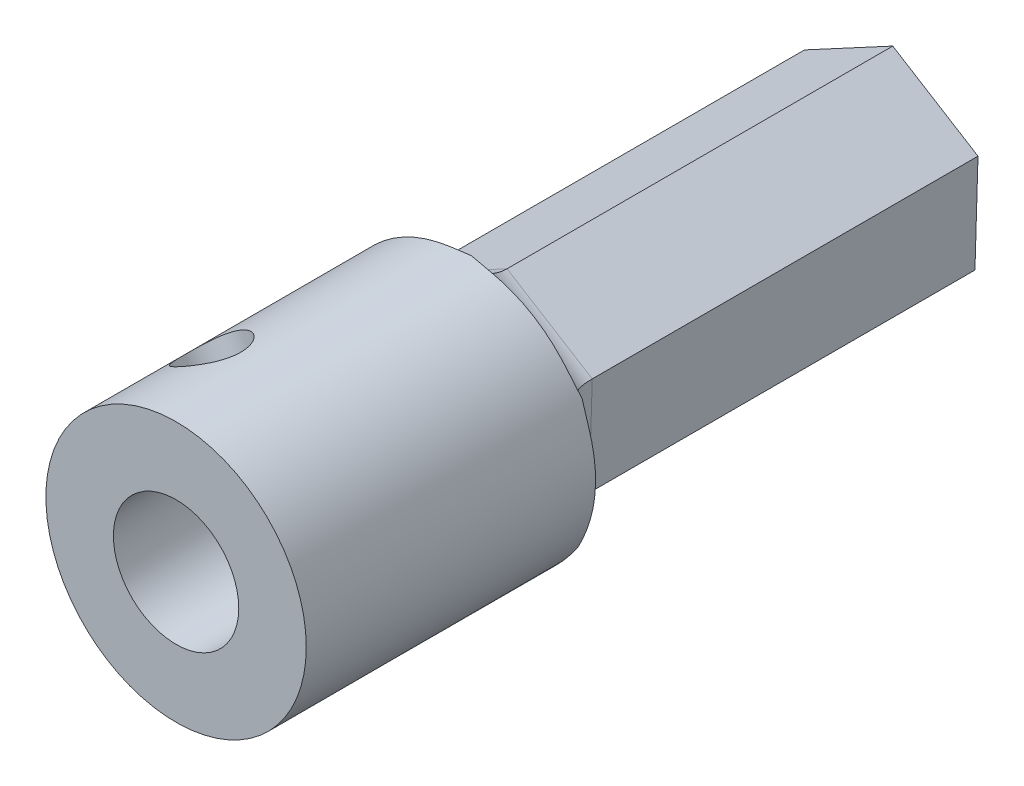
from build123d import *

# Parameters (mm, degrees)
BOSS_EXTRUDE1_DEPTH     = 22
SKETCH2_R               = 6.75
BOSS_EXTRUDE2_DEPTH     = 15
SKETCH3_R               = 3.25
CUT_EXTRUDE1_DEPTH      = 15
FILLET2_R               = 2
CUT_EXTRUDE2_DEPTH      = 15
CUT_EXTRUDE2_DEPTH_BACK = 15
SKETCH8_R               = 1.65
SKETCH9_R               = 1.65
CUT_EXTRUDE3_DEPTH      = 23


with BuildPart() as part:
    # Sketch1 → Boss-Extrude1 (new body)
    with BuildSketch(Plane.XY):
        Polygon((4.576818883, 2.460229443), (0.157788245, 5.193756143), (-4.419030638, 2.7335267), (-4.576818883, -2.460229443), (-0.157788245, -5.193756143), (4.419030638, -2.7335267), align=None)
    extrude(amount=BOSS_EXTRUDE1_DEPTH)

    # Sketch2 → Boss-Extrude2 (add)
    with BuildSketch(Plane.XY.offset(22)):
        Circle(SKETCH2_R)
    extrude(amount=BOSS_EXTRUDE2_DEPTH)

    # Sketch3 → Cut-Extrude1 (cut)
    with BuildSketch(Plane.XY.offset(37)):
        Circle(SKETCH3_R)
    extrude(amount=-CUT_EXTRUDE1_DEPTH, mode=Mode.SUBTRACT)

    # Fillet2
    # the kernel refuses this fillet: 2 mm, written as the material it adds along each edge
    with BuildSketch(Plane(origin=(-4.267198829, 7.731220878, 22), x_dir=(-0.9995388356967246, 0.03036636188344194, 0), z_dir=(-0.03036636188344194, -0.9995388356967246, 0))) as fillet2_piece_1_section:
        with BuildLine():
            CenterArc((FILLET2_R, FILLET2_R), FILLET2_R, 180, 90)
            Line((0, FILLET2_R), (0, 0))
            Line((0, 0), (FILLET2_R, 0))
        make_face()
    fillet2_piece_1 = extrude(amount=15.196152423, mode=Mode.PRIVATE)
    fillet2_piece_1 = split(fillet2_piece_1, bisect_by=Plane(origin=(-5.873586192, 1.951642931, 21.520073337), z_dir=(0.4734713770367902, -0.8808092047242045, 0)), keep=Keep.TOP, mode=Mode.PRIVATE)
    fillet2_piece_1 = split(fillet2_piece_1, bisect_by=Plane(origin=(-5.981227867, -1.591489267, 21.520073337), z_dir=(0.5260674586599344, 0.8504428428407627, 0)), keep=Keep.TOP, mode=Mode.PRIVATE)
    add(fillet2_piece_1)
    with BuildSketch(Plane(origin=(-8.829033097, 0.17010785, 22), x_dir=(-0.5260674586599344, -0.8504428428407628, 0), z_dir=(0.8504428428407627, -0.5260674586599344, 0))) as fillet2_piece_2_section:
        with BuildLine():
            CenterArc((FILLET2_R, FILLET2_R), FILLET2_R, 180, 90)
            Line((0, FILLET2_R), (0, 0))
            Line((0, 0), (FILLET2_R, 0))
        make_face()
    fillet2_piece_2 = extrude(amount=15.196152423, mode=Mode.PRIVATE)
    fillet2_piece_2 = split(fillet2_piece_2, bisect_by=Plane(origin=(-4.626965453, -4.110853388, 21.520073337), z_dir=(0.9995388356967246, -0.03036636188344194, 0)), keep=Keep.TOP, mode=Mode.PRIVATE)
    fillet2_piece_2 = split(fillet2_piece_2, bisect_by=Plane(origin=(-1.612343798, -5.975639912, 21.520073337), z_dir=(-0.47347137703679026, 0.8808092047242045, 0)), keep=Keep.TOP, mode=Mode.PRIVATE)
    add(fillet2_piece_2)
    with BuildSketch(Plane(origin=(-4.561834268, -7.561113028, 22), x_dir=(0.47347137703679026, -0.8808092047242045, 0), z_dir=(0.8808092047242045, 0.47347137703679026, 0))) as fillet2_piece_3_section:
        with BuildLine():
            CenterArc((FILLET2_R, FILLET2_R), FILLET2_R, 180, 90)
            Line((0, FILLET2_R), (0, 0))
            Line((0, 0), (FILLET2_R, 0))
        make_face()
    fillet2_piece_3 = extrude(amount=15.196152423, mode=Mode.PRIVATE)
    fillet2_piece_3 = split(fillet2_piece_3, bisect_by=Plane(origin=(1.246620739, -6.062496319, 21.520073337), z_dir=(0.5260674586599344, 0.8504428428407627, 0)), keep=Keep.TOP, mode=Mode.PRIVATE)
    fillet2_piece_3 = split(fillet2_piece_3, bisect_by=Plane(origin=(4.368884068, -4.384150645, 21.520073337), z_dir=(-0.9995388356967246, 0.030366361883441762, 0)), keep=Keep.TOP, mode=Mode.PRIVATE)
    add(fillet2_piece_3)
    with BuildSketch(Plane(origin=(4.267198829, -7.731220878, 22), x_dir=(0.9995388356967246, -0.030366361883441762, 0), z_dir=(0.030366361883441762, 0.9995388356967246, 0))) as fillet2_piece_4_section:
        with BuildLine():
            CenterArc((FILLET2_R, FILLET2_R), FILLET2_R, 180, 90)
            Line((0, FILLET2_R), (0, 0))
            Line((0, 0), (FILLET2_R, 0))
        make_face()
    fillet2_piece_4 = extrude(amount=15.196152423, mode=Mode.PRIVATE)
    fillet2_piece_4 = split(fillet2_piece_4, bisect_by=Plane(origin=(5.981227867, 1.591489267, 21.520073337), z_dir=(-0.5260674586599344, -0.8504428428407628, 0)), keep=Keep.TOP, mode=Mode.PRIVATE)
    fillet2_piece_4 = split(fillet2_piece_4, bisect_by=Plane(origin=(5.873586192, -1.951642931, 21.520073337), z_dir=(-0.47347137703679026, 0.8808092047242045, 0)), keep=Keep.TOP, mode=Mode.PRIVATE)
    add(fillet2_piece_4)
    with BuildSketch(Plane(origin=(8.829033097, -0.17010785, 22), x_dir=(0.5260674586599344, 0.8504428428407628, 0), z_dir=(-0.8504428428407628, 0.5260674586599344, 0))) as fillet2_piece_5_section:
        with BuildLine():
            CenterArc((FILLET2_R, FILLET2_R), FILLET2_R, 180, 90)
            Line((0, FILLET2_R), (0, 0))
            Line((0, 0), (FILLET2_R, 0))
        make_face()
    fillet2_piece_5 = extrude(amount=15.196152423, mode=Mode.PRIVATE)
    fillet2_piece_5 = split(fillet2_piece_5, bisect_by=Plane(origin=(4.626965453, 4.110853388, 21.520073337), z_dir=(-0.9995388356967246, 0.030366361883441762, 0)), keep=Keep.TOP, mode=Mode.PRIVATE)
    fillet2_piece_5 = split(fillet2_piece_5, bisect_by=Plane(origin=(1.612343798, 5.975639912, 21.520073337), z_dir=(0.4734713770367902, -0.8808092047242045, 0)), keep=Keep.TOP, mode=Mode.PRIVATE)
    add(fillet2_piece_5)
    with BuildSketch(Plane(origin=(4.561834268, 7.561113028, 22), x_dir=(-0.4734713770367902, 0.8808092047242045, 0), z_dir=(-0.8808092047242045, -0.4734713770367902, 0))) as fillet2_piece_6_section:
        with BuildLine():
            CenterArc((FILLET2_R, FILLET2_R), FILLET2_R, 180, 90)
            Line((0, FILLET2_R), (0, 0))
            Line((0, 0), (FILLET2_R, 0))
        make_face()
    fillet2_piece_6 = extrude(amount=15.196152423, mode=Mode.PRIVATE)
    fillet2_piece_6 = split(fillet2_piece_6, bisect_by=Plane(origin=(-1.246620739, 6.062496319, 21.520073337), z_dir=(-0.5260674586599344, -0.8504428428407628, 0)), keep=Keep.TOP, mode=Mode.PRIVATE)
    fillet2_piece_6 = split(fillet2_piece_6, bisect_by=Plane(origin=(-4.368884068, 4.384150645, 21.520073337), z_dir=(0.9995388356967246, -0.03036636188344194, 0)), keep=Keep.TOP, mode=Mode.PRIVATE)
    add(fillet2_piece_6)
    with BuildSketch(Plane(origin=(4.561834268, 7.561113028, 22), x_dir=(-0.4734713770367902, 0.8808092047242045, 0), z_dir=(-0.8808092047242045, -0.4734713770367902, 0))) as fillet2_piece_7a_section:
        with BuildLine():
            CenterArc((FILLET2_R, FILLET2_R), FILLET2_R, 180, 90)
            Line((0, FILLET2_R), (0, 0))
            Line((0, 0), (FILLET2_R, 0))
        make_face()
    fillet2_piece_7a = extrude(amount=15.196152423, mode=Mode.PRIVATE)
    fillet2_piece_7a = fillet2_piece_7a & Plane(origin=(0, 0, 21.516481321), x_dir=(1, 0, 0), z_dir=(0, 0, -1)) * Cylinder(6.75, 39, mode=Mode.PRIVATE)
    fillet2_piece_7a = split(fillet2_piece_7a, bisect_by=Plane(origin=(-4.422187766, 2.629606724, 21.516481321), z_dir=(-0.9995388356967246, 0.03036636188344194, 0)), keep=Keep.TOP, mode=Mode.PRIVATE)
    with BuildSketch(Plane(origin=(-4.267198829, 7.731220878, 22), x_dir=(-0.9995388356967246, 0.03036636188344194, 0), z_dir=(-0.03036636188344194, -0.9995388356967246, 0))) as fillet2_piece_7b_section:
        with BuildLine():
            CenterArc((FILLET2_R, FILLET2_R), FILLET2_R, 180, 90)
            Line((0, FILLET2_R), (0, 0))
            Line((0, 0), (FILLET2_R, 0))
        make_face()
    fillet2_piece_7b = extrude(amount=15.196152423, mode=Mode.PRIVATE)
    fillet2_piece_7b = fillet2_piece_7b & Plane(origin=(0, 0, 21.516480171), x_dir=(1, 0, 0), z_dir=(0, 0, -1)) * Cylinder(6.75, 39, mode=Mode.PRIVATE)
    fillet2_piece_7b = split(fillet2_piece_7b, bisect_by=Plane(origin=(-4.32745598, 2.782751866, 21.516480171), z_dir=(-0.4734713770367902, 0.8808092047242045, 0)), keep=Keep.TOP, mode=Mode.PRIVATE)
    fillet2_piece_7 = fillet2_piece_7a & fillet2_piece_7b
    add(fillet2_piece_7)
    with BuildSketch(Plane(origin=(-4.267198829, 7.731220878, 22), x_dir=(-0.9995388356967246, 0.03036636188344194, 0), z_dir=(-0.03036636188344194, -0.9995388356967246, 0))) as fillet2_piece_8a_section:
        with BuildLine():
            CenterArc((FILLET2_R, FILLET2_R), FILLET2_R, 180, 90)
            Line((0, FILLET2_R), (0, 0))
            Line((0, 0), (FILLET2_R, 0))
        make_face()
    fillet2_piece_8a = extrude(amount=15.196152423, mode=Mode.PRIVATE)
    fillet2_piece_8a = fillet2_piece_8a & Plane(origin=(0, 0, 21.516481321), x_dir=(1, 0, 0), z_dir=(0, 0, -1)) * Cylinder(6.75, 39, mode=Mode.PRIVATE)
    fillet2_piece_8a = split(fillet2_piece_8a, bisect_by=Plane(origin=(-4.488400107, -2.514923584, 21.516481321), z_dir=(-0.5260674586599344, -0.8504428428407627, 0)), keep=Keep.TOP, mode=Mode.PRIVATE)
    with BuildSketch(Plane(origin=(-8.829033097, 0.17010785, 22), x_dir=(-0.5260674586599344, -0.8504428428407628, 0), z_dir=(0.8504428428407627, -0.5260674586599344, 0))) as fillet2_piece_8b_section:
        with BuildLine():
            CenterArc((FILLET2_R, FILLET2_R), FILLET2_R, 180, 90)
            Line((0, FILLET2_R), (0, 0))
            Line((0, 0), (FILLET2_R, 0))
        make_face()
    fillet2_piece_8b = extrude(amount=15.196152423, mode=Mode.PRIVATE)
    fillet2_piece_8b = fillet2_piece_8b & Plane(origin=(0, 0, 21.516480171), x_dir=(1, 0, 0), z_dir=(0, 0, -1)) * Cylinder(6.75, 39, mode=Mode.PRIVATE)
    fillet2_piece_8b = split(fillet2_piece_8b, bisect_by=Plane(origin=(-4.573661798, -2.356310879, 21.516480171), z_dir=(-0.9995388356967246, 0.03036636188344194, 0)), keep=Keep.TOP, mode=Mode.PRIVATE)
    fillet2_piece_8 = fillet2_piece_8a & fillet2_piece_8b
    add(fillet2_piece_8)
    with BuildSketch(Plane(origin=(-8.829033097, 0.17010785, 22), x_dir=(-0.5260674586599344, -0.8504428428407628, 0), z_dir=(0.8504428428407627, -0.5260674586599344, 0))) as fillet2_piece_9a_section:
        with BuildLine():
            CenterArc((FILLET2_R, FILLET2_R), FILLET2_R, 180, 90)
            Line((0, FILLET2_R), (0, 0))
            Line((0, 0), (FILLET2_R, 0))
        make_face()
    fillet2_piece_9a = extrude(amount=15.196152423, mode=Mode.PRIVATE)
    fillet2_piece_9a = fillet2_piece_9a & Plane(origin=(0, 0, 21.516481321), x_dir=(1, 0, 0), z_dir=(0, 0, -1)) * Cylinder(6.75, 39, mode=Mode.PRIVATE)
    fillet2_piece_9a = split(fillet2_piece_9a, bisect_by=Plane(origin=(-0.066212341, -5.144530307, 21.516481321), z_dir=(0.47347137703679026, -0.8808092047242045, 0)), keep=Keep.TOP, mode=Mode.PRIVATE)
    with BuildSketch(Plane(origin=(-4.561834268, -7.561113028, 22), x_dir=(0.47347137703679026, -0.8808092047242045, 0), z_dir=(0.8808092047242045, 0.47347137703679026, 0))) as fillet2_piece_9b_section:
        with BuildLine():
            CenterArc((FILLET2_R, FILLET2_R), FILLET2_R, 180, 90)
            Line((0, FILLET2_R), (0, 0))
            Line((0, 0), (FILLET2_R, 0))
        make_face()
    fillet2_piece_9b = extrude(amount=15.196152423, mode=Mode.PRIVATE)
    fillet2_piece_9b = fillet2_piece_9b & Plane(origin=(0, 0, 21.516480171), x_dir=(1, 0, 0), z_dir=(0, 0, -1)) * Cylinder(6.75, 39, mode=Mode.PRIVATE)
    fillet2_piece_9b = split(fillet2_piece_9b, bisect_by=Plane(origin=(-0.246205818, -5.139062745, 21.516480171), z_dir=(-0.5260674586599344, -0.8504428428407627, 0)), keep=Keep.TOP, mode=Mode.PRIVATE)
    fillet2_piece_9 = fillet2_piece_9a & fillet2_piece_9b
    add(fillet2_piece_9)
    with BuildSketch(Plane(origin=(-4.561834268, -7.561113028, 22), x_dir=(0.47347137703679026, -0.8808092047242045, 0), z_dir=(0.8808092047242045, 0.47347137703679026, 0))) as fillet2_piece_10a_section:
        with BuildLine():
            CenterArc((FILLET2_R, FILLET2_R), FILLET2_R, 180, 90)
            Line((0, FILLET2_R), (0, 0))
            Line((0, 0), (FILLET2_R, 0))
        make_face()
    fillet2_piece_10a = extrude(amount=15.196152423, mode=Mode.PRIVATE)
    fillet2_piece_10a = fillet2_piece_10a & Plane(origin=(0, 0, 21.516481321), x_dir=(1, 0, 0), z_dir=(0, 0, -1)) * Cylinder(6.75, 39, mode=Mode.PRIVATE)
    fillet2_piece_10a = split(fillet2_piece_10a, bisect_by=Plane(origin=(4.422187766, -2.629606724, 21.516481321), z_dir=(0.9995388356967246, -0.030366361883441762, 0)), keep=Keep.TOP, mode=Mode.PRIVATE)
    with BuildSketch(Plane(origin=(4.267198829, -7.731220878, 22), x_dir=(0.9995388356967246, -0.030366361883441762, 0), z_dir=(0.030366361883441762, 0.9995388356967246, 0))) as fillet2_piece_10b_section:
        with BuildLine():
            CenterArc((FILLET2_R, FILLET2_R), FILLET2_R, 180, 90)
            Line((0, FILLET2_R), (0, 0))
            Line((0, 0), (FILLET2_R, 0))
        make_face()
    fillet2_piece_10b = extrude(amount=15.196152423, mode=Mode.PRIVATE)
    fillet2_piece_10b = fillet2_piece_10b & Plane(origin=(0, 0, 21.516480171), x_dir=(1, 0, 0), z_dir=(0, 0, -1)) * Cylinder(6.75, 39, mode=Mode.PRIVATE)
    fillet2_piece_10b = split(fillet2_piece_10b, bisect_by=Plane(origin=(4.32745598, -2.782751866, 21.516480171), z_dir=(0.47347137703679026, -0.8808092047242045, 0)), keep=Keep.TOP, mode=Mode.PRIVATE)
    fillet2_piece_10 = fillet2_piece_10a & fillet2_piece_10b
    add(fillet2_piece_10)
    with BuildSketch(Plane(origin=(8.829033097, -0.17010785, 22), x_dir=(0.5260674586599344, 0.8504428428407628, 0), z_dir=(-0.8504428428407628, 0.5260674586599344, 0))) as fillet2_piece_11a_section:
        with BuildLine():
            CenterArc((FILLET2_R, FILLET2_R), FILLET2_R, 180, 90)
            Line((0, FILLET2_R), (0, 0))
            Line((0, 0), (FILLET2_R, 0))
        make_face()
    fillet2_piece_11a = extrude(amount=15.196152423, mode=Mode.PRIVATE)
    fillet2_piece_11a = fillet2_piece_11a & Plane(origin=(0, 0, 21.516480171), x_dir=(1, 0, 0), z_dir=(0, 0, -1)) * Cylinder(6.75, 39, mode=Mode.PRIVATE)
    fillet2_piece_11a = split(fillet2_piece_11a, bisect_by=Plane(origin=(4.573661798, 2.356310879, 21.516480171), z_dir=(0.9995388356967246, -0.030366361883441762, 0)), keep=Keep.TOP, mode=Mode.PRIVATE)
    with BuildSketch(Plane(origin=(4.267198829, -7.731220878, 22), x_dir=(0.9995388356967246, -0.030366361883441762, 0), z_dir=(0.030366361883441762, 0.9995388356967246, 0))) as fillet2_piece_11b_section:
        with BuildLine():
            CenterArc((FILLET2_R, FILLET2_R), FILLET2_R, 180, 90)
            Line((0, FILLET2_R), (0, 0))
            Line((0, 0), (FILLET2_R, 0))
        make_face()
    fillet2_piece_11b = extrude(amount=15.196152423, mode=Mode.PRIVATE)
    fillet2_piece_11b = fillet2_piece_11b & Plane(origin=(0, 0, 21.516481321), x_dir=(1, 0, 0), z_dir=(0, 0, -1)) * Cylinder(6.75, 39, mode=Mode.PRIVATE)
    fillet2_piece_11b = split(fillet2_piece_11b, bisect_by=Plane(origin=(4.488400107, 2.514923584, 21.516481321), z_dir=(0.5260674586599344, 0.8504428428407628, 0)), keep=Keep.TOP, mode=Mode.PRIVATE)
    fillet2_piece_11 = fillet2_piece_11a & fillet2_piece_11b
    add(fillet2_piece_11)
    with BuildSketch(Plane(origin=(8.829033097, -0.17010785, 22), x_dir=(0.5260674586599344, 0.8504428428407628, 0), z_dir=(-0.8504428428407628, 0.5260674586599344, 0))) as fillet2_piece_12a_section:
        with BuildLine():
            CenterArc((FILLET2_R, FILLET2_R), FILLET2_R, 180, 90)
            Line((0, FILLET2_R), (0, 0))
            Line((0, 0), (FILLET2_R, 0))
        make_face()
    fillet2_piece_12a = extrude(amount=15.196152423, mode=Mode.PRIVATE)
    fillet2_piece_12a = fillet2_piece_12a & Plane(origin=(0, 0, 21.516481321), x_dir=(1, 0, 0), z_dir=(0, 0, -1)) * Cylinder(6.75, 39, mode=Mode.PRIVATE)
    fillet2_piece_12a = split(fillet2_piece_12a, bisect_by=Plane(origin=(0.066212341, 5.144530307, 21.516481321), z_dir=(-0.4734713770367902, 0.8808092047242045, 0)), keep=Keep.TOP, mode=Mode.PRIVATE)
    with BuildSketch(Plane(origin=(4.561834268, 7.561113028, 22), x_dir=(-0.4734713770367902, 0.8808092047242045, 0), z_dir=(-0.8808092047242045, -0.4734713770367902, 0))) as fillet2_piece_12b_section:
        with BuildLine():
            CenterArc((FILLET2_R, FILLET2_R), FILLET2_R, 180, 90)
            Line((0, FILLET2_R), (0, 0))
            Line((0, 0), (FILLET2_R, 0))
        make_face()
    fillet2_piece_12b = extrude(amount=15.196152423, mode=Mode.PRIVATE)
    fillet2_piece_12b = fillet2_piece_12b & Plane(origin=(0, 0, 21.516480171), x_dir=(1, 0, 0), z_dir=(0, 0, -1)) * Cylinder(6.75, 39, mode=Mode.PRIVATE)
    fillet2_piece_12b = split(fillet2_piece_12b, bisect_by=Plane(origin=(0.246205818, 5.139062745, 21.516480171), z_dir=(0.5260674586599344, 0.8504428428407628, 0)), keep=Keep.TOP, mode=Mode.PRIVATE)
    fillet2_piece_12 = fillet2_piece_12a & fillet2_piece_12b
    add(fillet2_piece_12)

    # Sketch8 → Cut-Extrude2 (cut, two sides: drawn at the far end of the back side and taken through both)
    with BuildSketch(Plane(origin=(2.130621197, -3.963641421, 0), x_dir=(-0.8808092047242045, -0.4734713770367903, 0), z_dir=(0.4734713770367903, -0.8808092047242045, 0)).offset(-CUT_EXTRUDE2_DEPTH_BACK)):
        with Locations((0, -32)):
            Circle(SKETCH8_R)
    extrude(amount=CUT_EXTRUDE2_DEPTH + CUT_EXTRUDE2_DEPTH_BACK, mode=Mode.SUBTRACT)

    # Sketch9 → Cut-Extrude3 (cut)
    with BuildSketch(Plane(origin=(0, 0, 0), x_dir=(-1, 0, 0), z_dir=(0, 0, -1))):
        Circle(SKETCH9_R)
    extrude(amount=-CUT_EXTRUDE3_DEPTH, mode=Mode.SUBTRACT)


solid = part.part
